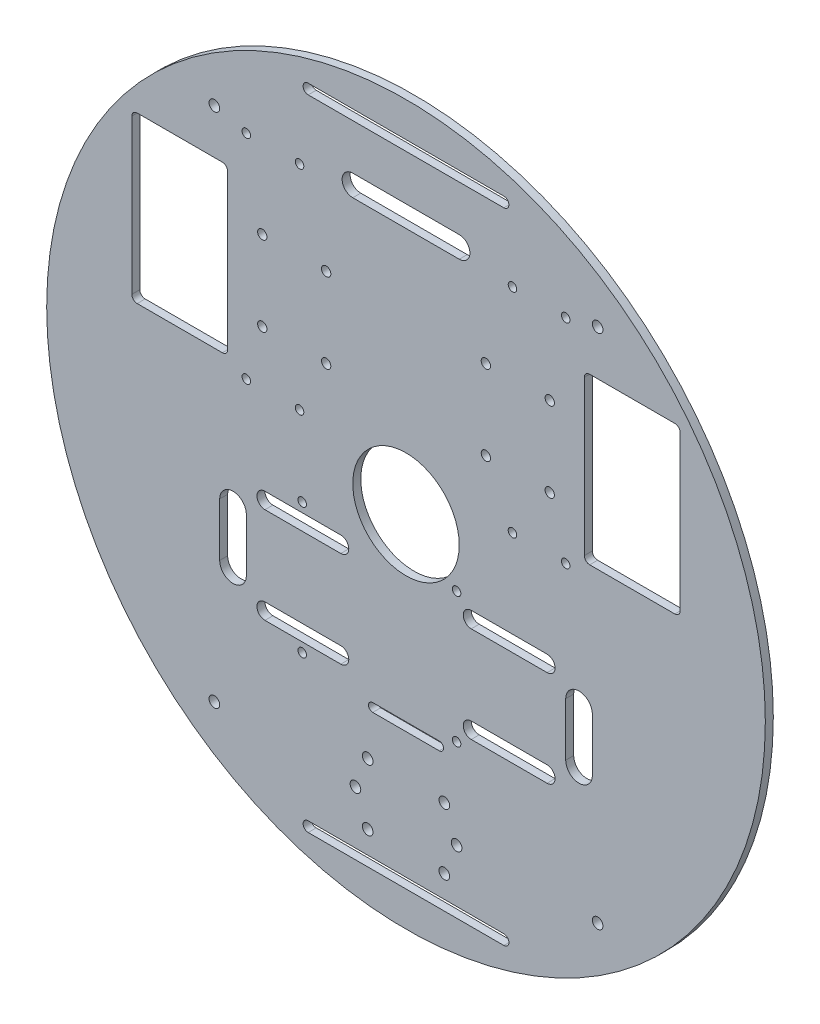
from build123d import *

# Parameters (mm, degrees)
SKETCH_1_R          = 135
SKETCH_1_R_2        = 2
SKETCH_1_W          = 36
SKETCH_1_H          = 62
SKETCH_1_R_3        = 1.75
EXTRUDE_1_DEPTH     = 3
FILLET_1_R          = 2
SKETCH_2_R          = 20
SKETCH_2_R_2        = 2
SKETCH_2_R_3        = 1.6
CUT_EXTRUDE_1_DEPTH = 10


with BuildPart() as part:
    # 草图1 → 凸台-拉伸1 (new body)
    with BuildSketch(Plane.XY):
        Circle(SKETCH_1_R)
        with Locations((-14.4, -109.649545762)):
            Circle(SKETCH_1_R_2, mode=Mode.SUBTRACT)
        with Locations((-19, -98.149545762)):
            Circle(SKETCH_1_R_2, mode=Mode.SUBTRACT)
        with Locations((-14.4, -86.649545762)):
            Circle(SKETCH_1_R_2, mode=Mode.SUBTRACT)
        with Locations((14.4, -109.649545762)):
            Circle(SKETCH_1_R_2, mode=Mode.SUBTRACT)
        with Locations((14.4, -86.649545762)):
            Circle(SKETCH_1_R_2, mode=Mode.SUBTRACT)
        with Locations((19, -98.149545762)):
            Circle(SKETCH_1_R_2, mode=Mode.SUBTRACT)
        with Locations((-85, 49.074772881)):
            Rectangle(SKETCH_1_W, SKETCH_1_H, mode=Mode.SUBTRACT)
        with Locations((-54, 34.074772881)):
            Circle(SKETCH_1_R_3, mode=Mode.SUBTRACT)
        with Locations((-54, 64.074772881)):
            Circle(SKETCH_1_R_3, mode=Mode.SUBTRACT)
        with Locations((-30, 34.074772881)):
            Circle(SKETCH_1_R_3, mode=Mode.SUBTRACT)
        with Locations((-30, 64.074772881)):
            Circle(SKETCH_1_R_3, mode=Mode.SUBTRACT)
        with Locations((30, 34.074772881)):
            Circle(SKETCH_1_R_3, mode=Mode.SUBTRACT)
        with Locations((30, 64.074772881)):
            Circle(SKETCH_1_R_3, mode=Mode.SUBTRACT)
        with Locations((54, 34.074772881)):
            Circle(SKETCH_1_R_3, mode=Mode.SUBTRACT)
        with Locations((54, 64.074772881)):
            Circle(SKETCH_1_R_3, mode=Mode.SUBTRACT)
        with Locations((85, 49.074772881)):
            Rectangle(SKETCH_1_W, SKETCH_1_H, mode=Mode.SUBTRACT)
    extrude(amount=EXTRUDE_1_DEPTH)

    # 圆角1
    fillet_1_edges = [part.edges().sort_by_distance(p)[0] for p in [
        (103, 80.074772881, 1.5),
        (67, 80.074772881, 1.5),
        (67, 18.074772881, 1.5),
        (103, 18.074772881, 1.5),
        (-67, 18.074772881, 1.5),
        (-103, 18.074772881, 1.5),
        (-103, 80.074772881, 1.5),
        (-67, 80.074772881, 1.5),
    ]]
    fillet(fillet_1_edges, radius=FILLET_1_R)

    # 草图2 → 切除-拉伸1 (cut)
    with BuildSketch(Plane.XY.offset(3)):
        Circle(SKETCH_2_R)
        with Locations((-72, 97)):
            Circle(SKETCH_2_R_2)
        with Locations((72, 97)):
            Circle(SKETCH_2_R_2)
        with Locations((72, -97)):
            Circle(SKETCH_2_R_2)
        with Locations((-72, -97)):
            Circle(SKETCH_2_R_2)
        with Locations((-60, 94)):
            Circle(SKETCH_2_R_3)
        with Locations((-60, 14)):
            Circle(SKETCH_2_R_3)
        with Locations((-40, 94)):
            Circle(SKETCH_2_R_3)
        with Locations((-40, 14)):
            Circle(SKETCH_2_R_3)
        with Locations((60, 14)):
            Circle(SKETCH_2_R_3)
        with Locations((60, 94)):
            Circle(SKETCH_2_R_3)
        with Locations((40, 94)):
            Circle(SKETCH_2_R_3)
        with Locations((40, 14)):
            Circle(SKETCH_2_R_3)
        with Locations((-39, -15.5)):
            Circle(SKETCH_2_R_3)
        with Locations((19, -15.5)):
            Circle(SKETCH_2_R_3)
        with Locations((-39, -64.5)):
            Circle(SKETCH_2_R_3)
        with Locations((19, -64.5)):
            Circle(SKETCH_2_R_3)
        with BuildLine():
            Line((24.505636669, -55), (53, -55))
            ThreePointArc((53, -55), (56, -58), (53, -61))
            Line((53, -61), (24.505636669, -61))
            ThreePointArc((24.505636669, -61), (21.505636669, -58), (24.505636669, -55))
        make_face()
        with BuildLine():
            Line((-53, -19), (-24.505636669, -19))
            ThreePointArc((-24.505636669, -19), (-21.505636669, -22), (-24.505636669, -25))
            Line((-24.505636669, -25), (-53, -25))
            ThreePointArc((-53, -25), (-56, -22), (-53, -19))
        make_face()
        with BuildLine():
            Line((-53, -61), (-24.505636669, -61))
            ThreePointArc((-24.505636669, -61), (-21.505636669, -58), (-24.505636669, -55))
            Line((-24.505636669, -55), (-53, -55))
            ThreePointArc((-53, -55), (-56, -58), (-53, -61))
        make_face()
        with BuildLine():
            Line((24.505636669, -25), (53, -25))
            ThreePointArc((53, -25), (56, -22), (53, -19))
            Line((53, -19), (24.505636669, -19))
            ThreePointArc((24.505636669, -19), (21.505636669, -22), (24.505636669, -25))
        make_face()
        with BuildLine():
            Line((-70, -30), (-70, -50))
            ThreePointArc((-70, -50), (-65, -55), (-60, -50))
            Line((-60, -50), (-60, -30))
            ThreePointArc((-60, -30), (-65, -25), (-70, -30))
        make_face()
        with BuildLine():
            Line((60, -30), (60, -50))
            ThreePointArc((60, -50), (65, -55), (70, -50))
            Line((70, -50), (70, -30))
            ThreePointArc((70, -30), (65, -25), (60, -30))
        make_face()
        with BuildLine():
            Line((-36.755588957, 121.9), (36.755588957, 121.9))
            ThreePointArc((36.755588957, 121.9), (38.655588957, 120), (36.755588957, 118.1))
            Line((36.755588957, 118.1), (-36.755588957, 118.1))
            ThreePointArc((-36.755588957, 118.1), (-38.655588957, 120), (-36.755588957, 121.9))
        make_face()
        with BuildLine():
            Line((-36.755588957, -118.1), (36.755588957, -118.1))
            ThreePointArc((36.755588957, -118.1), (38.655588957, -120), (36.755588957, -121.9))
            Line((36.755588957, -121.9), (-36.755588957, -121.9))
            ThreePointArc((-36.755588957, -121.9), (-38.655588957, -120), (-36.755588957, -118.1))
        make_face()
        with BuildLine():
            Line((12.5, -70.7), (-12.5, -70.7))
            ThreePointArc((-12.5, -70.7), (-14.1, -69.1), (-12.5, -67.5))
            Line((-12.5, -67.5), (12.5, -67.5))
            ThreePointArc((12.5, -67.5), (14.1, -69.1), (12.5, -70.7))
        make_face()
        with BuildLine():
            Line((20, 101), (-20, 101))
            ThreePointArc((-20, 101), (-24, 97), (-20, 93))
            Line((-20, 93), (20, 93))
            ThreePointArc((20, 93), (24, 97), (20, 101))
        make_face()
    extrude(amount=-CUT_EXTRUDE_1_DEPTH, mode=Mode.SUBTRACT)


solid = part.part
